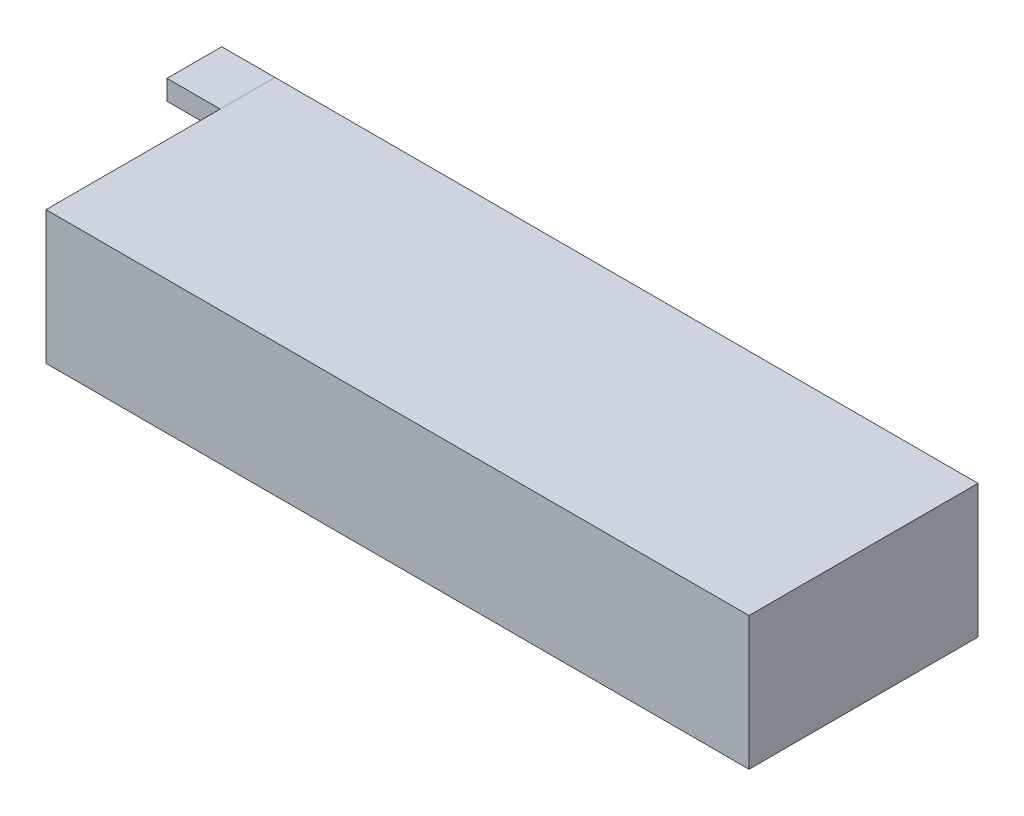
from build123d import *

# Parameters (mm, degrees)
SKETCH1_W           = 132
SKETCH1_H           = 43
BOSS_EXTRUDE1_DEPTH = 25
SKETCH2_W           = 10.279782108
SKETCH2_H           = 3.729128279
BOSS_EXTRUDE2_DEPTH = 10


with BuildPart() as part:
    # Sketch1 → Boss-Extrude1 (new body)
    with BuildSketch(Plane(origin=(0, 0, 0), x_dir=(1, 0, 0), z_dir=(0, 1, 0))):
        with Locations((66, -21.5)):
            Rectangle(SKETCH1_W, SKETCH1_H)
    extrude(amount=BOSS_EXTRUDE1_DEPTH)

    # Sketch2 → Boss-Extrude2 (add)
    with BuildSketch(Plane.ZY):
        with Locations((5.139891054, 23.130841668)):
            Rectangle(SKETCH2_W, SKETCH2_H)
    extrude(amount=BOSS_EXTRUDE2_DEPTH)


solid = part.part
